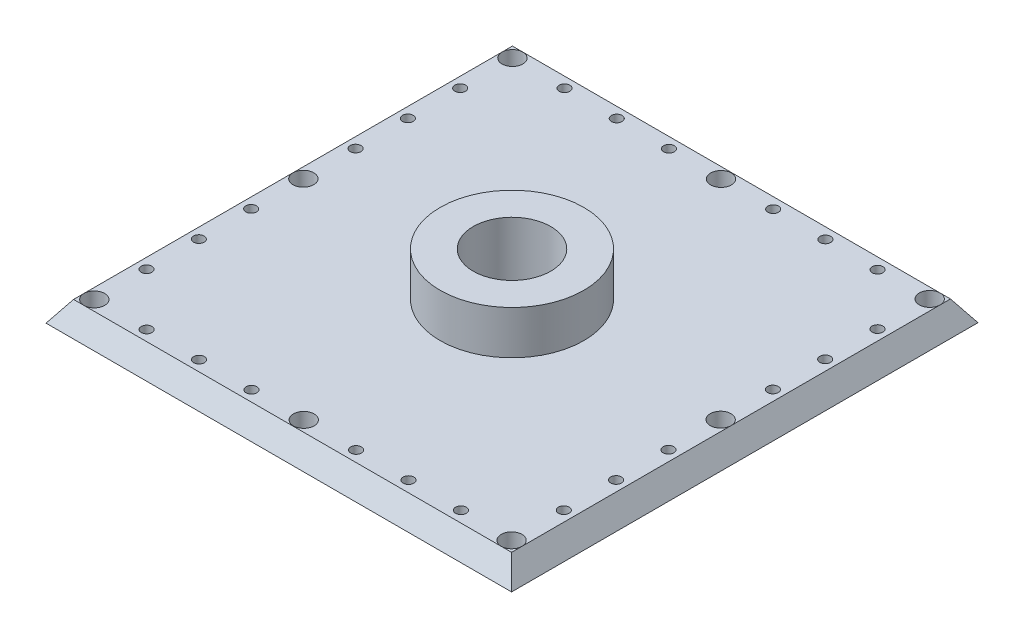
from build123d import *
from OCP.BRepFilletAPI import BRepFilletAPI_MakeChamfer

# Parameters (mm, degrees)
CROQUIS1_W              = 226.5
CROQUIS1_H              = 226.9
CROQUIS1_R              = 18.85
CROQUIS1_R_2            = 5.05
CROQUIS1_R_3            = 2.6
SALIENTE_EXTRUIR1_DEPTH = 10
CHAFL_N1_SIZE           = 10
CHAFL_N1_SIZE_2         = 6.7
CROQUIS5_R              = 34.95
CROQUIS5_R_2            = 18.85
SALIENTE_EXTRUIR7_DEPTH = 21.2


with BuildPart() as part:
    # Croquis1 → Saliente-Extruir1 (new body)
    with BuildSketch(Plane(origin=(0, 0, 0), x_dir=(1, 0, 0), z_dir=(0, 1, 0))):
        Rectangle(CROQUIS1_W, CROQUIS1_H)
        with Locations(Location((0, 0, 0), (0, 0, 270))):
            Circle(CROQUIS1_R, mode=Mode.SUBTRACT)
        with Locations(Location((-101.5, 0, 0), (0, 0, 270))):
            Circle(CROQUIS1_R_2, mode=Mode.SUBTRACT)
        with Locations(Location((-101.5, -25.4, 0), (0, 0, 270))):
            Circle(CROQUIS1_R_3, mode=Mode.SUBTRACT)
        with Locations(Location((-101.5, -50.85, 0), (0, 0, 270))):
            Circle(CROQUIS1_R_3, mode=Mode.SUBTRACT)
        with Locations(Location((-101.5, -76.3, 0), (0, 0, 270))):
            Circle(CROQUIS1_R_3, mode=Mode.SUBTRACT)
        with Locations(Location((-101.5, -101.7, 0), (0, 0, 270))):
            Circle(CROQUIS1_R_2, mode=Mode.SUBTRACT)
        with Locations(Location((-101.5, 101.7, 0), (0, 0, 90))):
            Circle(CROQUIS1_R_2, mode=Mode.SUBTRACT)
        with Locations(Location((-101.5, 76.3, 0), (0, 0, 90))):
            Circle(CROQUIS1_R_3, mode=Mode.SUBTRACT)
        with Locations(Location((-101.5, 50.85, 0), (0, 0, 90))):
            Circle(CROQUIS1_R_3, mode=Mode.SUBTRACT)
        with Locations(Location((-101.5, 25.4, 0), (0, 0, 90))):
            Circle(CROQUIS1_R_3, mode=Mode.SUBTRACT)
        with Locations(Location((101.5, -101.7, 0), (0, 0, 90))):
            Circle(CROQUIS1_R_2, mode=Mode.SUBTRACT)
        with Locations(Location((101.5, -76.3, 0), (0, 0, 90))):
            Circle(CROQUIS1_R_3, mode=Mode.SUBTRACT)
        with Locations(Location((101.5, -50.85, 0), (0, 0, 90))):
            Circle(CROQUIS1_R_3, mode=Mode.SUBTRACT)
        with Locations(Location((101.5, -25.4, 0), (0, 0, 90))):
            Circle(CROQUIS1_R_3, mode=Mode.SUBTRACT)
        with Locations(Location((101.5, 0, 0), (0, 0, 90))):
            Circle(CROQUIS1_R_2, mode=Mode.SUBTRACT)
        with Locations(Location((101.5, 25.4, 0), (0, 0, 270))):
            Circle(CROQUIS1_R_3, mode=Mode.SUBTRACT)
        with Locations(Location((101.5, 50.85, 0), (0, 0, 270))):
            Circle(CROQUIS1_R_3, mode=Mode.SUBTRACT)
        with Locations(Location((101.5, 76.3, 0), (0, 0, 270))):
            Circle(CROQUIS1_R_3, mode=Mode.SUBTRACT)
        with Locations(Location((101.5, 101.7, 0), (0, 0, 270))):
            Circle(CROQUIS1_R_2, mode=Mode.SUBTRACT)
        with Locations(Location((76.499655125, 101.349606639, 0), (0, 0, 90))):
            Circle(CROQUIS1_R_3, mode=Mode.SUBTRACT)
        with Locations(Location((51.049704434, 101.399705015, 0), (0, 0, 90))):
            Circle(CROQUIS1_R_3, mode=Mode.SUBTRACT)
        with Locations(Location((25.599753743, 101.449803392, 0), (0, 0, 90))):
            Circle(CROQUIS1_R_3, mode=Mode.SUBTRACT)
        with Locations(Location((0.199802956, 101.499803344, 0), (0, 0, 90))):
            Circle(CROQUIS1_R_2, mode=Mode.SUBTRACT)
        with Locations(Location((-25.200147831, 101.549803295, 0), (0, 0, 270))):
            Circle(CROQUIS1_R_3, mode=Mode.SUBTRACT)
        with Locations(Location((-50.650098522, 101.599901672, 0), (0, 0, 270))):
            Circle(CROQUIS1_R_3, mode=Mode.SUBTRACT)
        with Locations(Location((-76.100049213, 101.650000048, 0), (0, 0, 270))):
            Circle(CROQUIS1_R_3, mode=Mode.SUBTRACT)
        with Locations(Location((76.499655125, -101.349606639, 0), (0, 0, 270))):
            Circle(CROQUIS1_R_3, mode=Mode.SUBTRACT)
        with Locations(Location((51.049704434, -101.399705015, 0), (0, 0, 270))):
            Circle(CROQUIS1_R_3, mode=Mode.SUBTRACT)
        with Locations(Location((25.599753743, -101.449803392, 0), (0, 0, 270))):
            Circle(CROQUIS1_R_3, mode=Mode.SUBTRACT)
        with Locations(Location((0.199802956, -101.499803344, 0), (0, 0, 270))):
            Circle(CROQUIS1_R_2, mode=Mode.SUBTRACT)
        with Locations(Location((-25.200147831, -101.549803295, 0), (0, 0, 90))):
            Circle(CROQUIS1_R_3, mode=Mode.SUBTRACT)
        with Locations(Location((-50.650098522, -101.599901672, 0), (0, 0, 90))):
            Circle(CROQUIS1_R_3, mode=Mode.SUBTRACT)
        with Locations(Location((-76.100049213, -101.650000048, 0), (0, 0, 90))):
            Circle(CROQUIS1_R_3, mode=Mode.SUBTRACT)
    extrude(amount=SALIENTE_EXTRUIR1_DEPTH)

    # Chaflán1
    chafl_n1_edges_1 = [part.edges().sort_by_distance(p)[0] for p in [
        (0, 10, -113.45),
    ]]
    chafl_n1_side_1 = [part.faces().sort_by_distance(p)[0] for p in [
        (0, 9.866, -113.45),
    ]]
    chafl_n1_edges_2 = [part.edges().sort_by_distance(p)[0] for p in [
        (113.25, 10, 0),
    ]]
    chafl_n1_side_2 = [part.faces().sort_by_distance(p)[0] for p in [
        (113.25, 9.866, 0),
    ]]
    chafl_n1_edges_3 = [part.edges().sort_by_distance(p)[0] for p in [
        (0, 10, 113.45),
    ]]
    chafl_n1_side_3 = [part.faces().sort_by_distance(p)[0] for p in [
        (0, 9.866, 113.45),
    ]]
    chafl_n1_edges_4 = [part.edges().sort_by_distance(p)[0] for p in [
        (-113.25, 10, 0),
    ]]
    chafl_n1_side_4 = [part.faces().sort_by_distance(p)[0] for p in [
        (-113.25, 9.866, 0),
    ]]
    chafl_n1 = BRepFilletAPI_MakeChamfer(part.part.solid().wrapped)
    for e in chafl_n1_edges_1:
        chafl_n1.Add(CHAFL_N1_SIZE - 0.0001, CHAFL_N1_SIZE_2 - 0.0001, e.wrapped, chafl_n1_side_1[0].wrapped)
    for e in chafl_n1_edges_2:
        chafl_n1.Add(CHAFL_N1_SIZE - 0.0001, CHAFL_N1_SIZE_2 - 0.0001, e.wrapped, chafl_n1_side_2[0].wrapped)
    for e in chafl_n1_edges_3:
        chafl_n1.Add(CHAFL_N1_SIZE - 0.0001, CHAFL_N1_SIZE_2 - 0.0001, e.wrapped, chafl_n1_side_3[0].wrapped)
    for e in chafl_n1_edges_4:
        chafl_n1.Add(CHAFL_N1_SIZE - 0.0001, CHAFL_N1_SIZE_2 - 0.0001, e.wrapped, chafl_n1_side_4[0].wrapped)
    add(Compound.cast(chafl_n1.Shape()), mode=Mode.REPLACE)  # a hair under: the kernel refuses the full size

    # Croquis5 → Saliente-Extruir7 (add)
    with BuildSketch(Plane(origin=(0, 10, 0), x_dir=(1, 0, 0), z_dir=(0, 1, 0))):
        with Locations(Location((0, 0, 0), (0, 0, 270))):
            Circle(CROQUIS5_R)
        with Locations(Location((0, 0, 0), (0, 0, 270))):
            Circle(CROQUIS5_R_2, mode=Mode.SUBTRACT)
    extrude(amount=SALIENTE_EXTRUIR7_DEPTH)


solid = part.part
